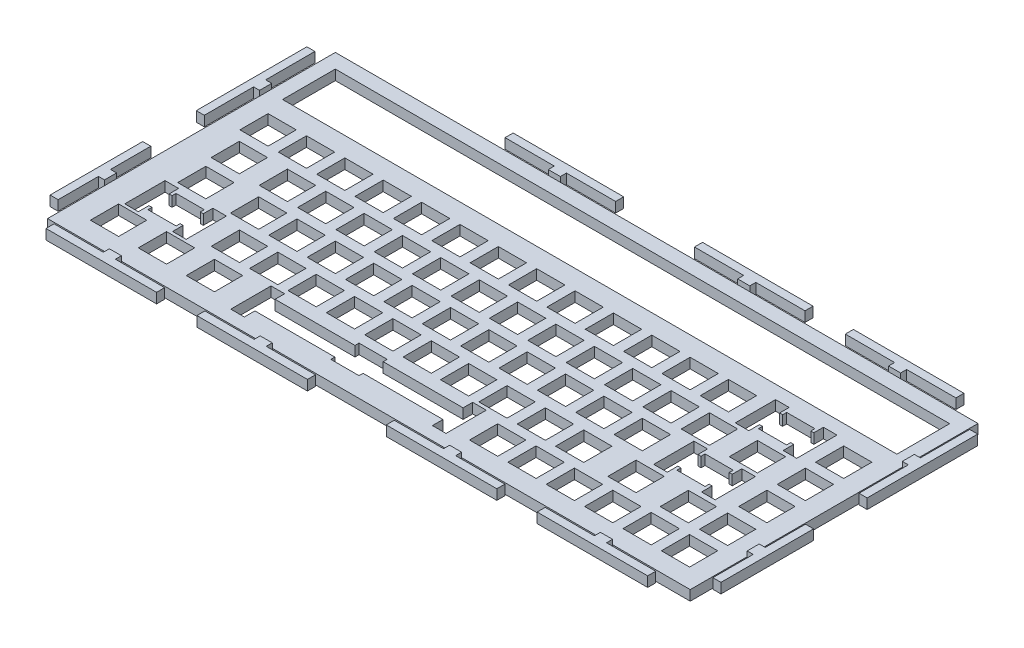
from build123d import *

# Parameters (mm, degrees)
SKETCH1_W           = 319.08
SKETCH1_H           = 142.875
SKETCH1_W_2         = 14
SKETCH1_H_2         = 14
SKETCH1_W_3         = 305
SKETCH1_H_3         = 26.2
BOSS_EXTRUDE2_DEPTH = 2.5
BOSS_EXTRUDE3_DEPTH = 2.5


with BuildPart() as part:
    # Sketch1 → Boss-Extrude2 (new, symmetric)
    with BuildSketch(Plane(origin=(0, 0, 0), x_dir=(1, 0, 0), z_dir=(0, 1, 0))):
        with Locations((55.118496059, 23.552072889)):
            Rectangle(SKETCH1_W, SKETCH1_H)
        with Locations((-68.754503941, 44.995572889)):
            Rectangle(SKETCH1_W_2, SKETCH1_H_2, mode=Mode.SUBTRACT)
        with Locations((-87.826503941, 44.995572889)):
            Rectangle(SKETCH1_W_2, SKETCH1_H_2, mode=Mode.SUBTRACT)
        with Locations((140.749496059, 44.995572889)):
            Rectangle(SKETCH1_W_2, SKETCH1_H_2, mode=Mode.SUBTRACT)
        with Locations((-30.654503941, 44.995572889)):
            Rectangle(SKETCH1_W_2, SKETCH1_H_2, mode=Mode.SUBTRACT)
        with Locations((-49.704503941, 44.995572889)):
            Rectangle(SKETCH1_W_2, SKETCH1_H_2, mode=Mode.SUBTRACT)
        with Locations((7.445496059, 44.995572889)):
            Rectangle(SKETCH1_W_2, SKETCH1_H_2, mode=Mode.SUBTRACT)
        with Locations((-11.604503941, 44.995572889)):
            Rectangle(SKETCH1_W_2, SKETCH1_H_2, mode=Mode.SUBTRACT)
        with Locations((45.545496059, 44.995572889)):
            Rectangle(SKETCH1_W_2, SKETCH1_H_2, mode=Mode.SUBTRACT)
        with Locations((26.495496059, 44.995572889)):
            Rectangle(SKETCH1_W_2, SKETCH1_H_2, mode=Mode.SUBTRACT)
        with Locations((174.183496059, 25.945572889)):
            Rectangle(SKETCH1_W_2, SKETCH1_H_2, mode=Mode.SUBTRACT)
        with Locations((83.645496059, 44.995572889)):
            Rectangle(SKETCH1_W_2, SKETCH1_H_2, mode=Mode.SUBTRACT)
        with Locations((64.595496059, 44.995572889)):
            Rectangle(SKETCH1_W_2, SKETCH1_H_2, mode=Mode.SUBTRACT)
        with Locations((121.722496059, 44.995572889)):
            Rectangle(SKETCH1_W_2, SKETCH1_H_2, mode=Mode.SUBTRACT)
        with Locations((102.695496059, 44.995572889)):
            Rectangle(SKETCH1_W_2, SKETCH1_H_2, mode=Mode.SUBTRACT)
        Polygon((162.399496059, 52.245572889), (176.399496059, 52.245572889), (176.399496059, 50.245572889), (177.899496059, 50.245572889), (177.899496059, 54.995572889), (184.649496059, 54.995572889), (184.649496059, 34.995572889), (177.899496059, 34.995572889), (177.899496059, 40.245572889), (176.399496059, 40.245572889), (176.399496059, 38.245572889), (162.399496059, 38.245572889), (162.399496059, 40.245572889), (160.899496059, 40.245572889), (160.899496059, 34.995572889), (154.149496059, 34.995572889), (154.149496059, 54.995572889), (160.899496059, 54.995572889), (160.899496059, 50.245572889), (162.399496059, 50.245572889), align=None, mode=Mode.SUBTRACT)
        with Locations((-40.126503941, 25.945572889)):
            Rectangle(SKETCH1_W_2, SKETCH1_H_2, mode=Mode.SUBTRACT)
        with Locations((-59.176503941, 25.945572889)):
            Rectangle(SKETCH1_W_2, SKETCH1_H_2, mode=Mode.SUBTRACT)
        with Locations((-2.051503941, 25.945572889)):
            Rectangle(SKETCH1_W_2, SKETCH1_H_2, mode=Mode.SUBTRACT)
        with Locations((-21.076503941, 25.945572889)):
            Rectangle(SKETCH1_W_2, SKETCH1_H_2, mode=Mode.SUBTRACT)
        with Locations((36.073496059, 25.945572889)):
            Rectangle(SKETCH1_W_2, SKETCH1_H_2, mode=Mode.SUBTRACT)
        with Locations((16.948496059, 25.945572889)):
            Rectangle(SKETCH1_W_2, SKETCH1_H_2, mode=Mode.SUBTRACT)
        with Locations((74.148496059, 25.945572889)):
            Rectangle(SKETCH1_W_2, SKETCH1_H_2, mode=Mode.SUBTRACT)
        with Locations((55.123496059, 25.945572889)):
            Rectangle(SKETCH1_W_2, SKETCH1_H_2, mode=Mode.SUBTRACT)
        Polygon((159.986496059, 14.145572889), (173.986496059, 14.145572889), (173.986496059, 12.145572889), (175.486496059, 12.145572889), (175.486496059, 16.895572889), (182.236496059, 16.895572889), (182.236496059, -3.104427111), (175.486496059, -3.104427111), (175.486496059, 2.145572889), (173.986496059, 2.145572889), (173.986496059, 0.145572889), (159.986496059, 0.145572889), (159.986496059, 2.145572889), (158.486496059, 2.145572889), (158.486496059, -3.104427111), (151.736496059, -3.104427111), (151.736496059, 16.895572889), (158.486496059, 16.895572889), (158.486496059, 12.145572889), (159.986496059, 12.145572889), align=None, mode=Mode.SUBTRACT)
        with Locations((-35.363503941, 6.895572889)):
            Rectangle(SKETCH1_W_2, SKETCH1_H_2, mode=Mode.SUBTRACT)
        with Locations((-54.413503941, 6.895572889)):
            Rectangle(SKETCH1_W_2, SKETCH1_H_2, mode=Mode.SUBTRACT)
        with Locations((112.273496059, 25.945572889)):
            Rectangle(SKETCH1_W_2, SKETCH1_H_2, mode=Mode.SUBTRACT)
        with Locations((93.223496059, 25.945572889)):
            Rectangle(SKETCH1_W_2, SKETCH1_H_2, mode=Mode.SUBTRACT)
        with Locations((-83.063503941, 25.945572889)):
            Rectangle(SKETCH1_W_2, SKETCH1_H_2, mode=Mode.SUBTRACT)
        with Locations((131.323496059, 25.945572889)):
            Rectangle(SKETCH1_W_2, SKETCH1_H_2, mode=Mode.SUBTRACT)
        with Locations((150.373496059, 25.945572889)):
            Rectangle(SKETCH1_W_2, SKETCH1_H_2, mode=Mode.SUBTRACT)
        with Locations((2.736496059, 6.895572889)):
            Rectangle(SKETCH1_W_2, SKETCH1_H_2, mode=Mode.SUBTRACT)
        with Locations((-16.313503941, 6.895572889)):
            Rectangle(SKETCH1_W_2, SKETCH1_H_2, mode=Mode.SUBTRACT)
        with Locations((40.836496059, 6.895572889)):
            Rectangle(SKETCH1_W_2, SKETCH1_H_2, mode=Mode.SUBTRACT)
        with Locations((21.786496059, 6.895572889)):
            Rectangle(SKETCH1_W_2, SKETCH1_H_2, mode=Mode.SUBTRACT)
        with Locations((78.936496059, 6.895572889)):
            Rectangle(SKETCH1_W_2, SKETCH1_H_2, mode=Mode.SUBTRACT)
        with Locations((59.886496059, 6.895572889)):
            Rectangle(SKETCH1_W_2, SKETCH1_H_2, mode=Mode.SUBTRACT)
        with Locations((117.036496059, 6.895572889)):
            Rectangle(SKETCH1_W_2, SKETCH1_H_2, mode=Mode.SUBTRACT)
        with Locations((97.986496059, 6.895572889)):
            Rectangle(SKETCH1_W_2, SKETCH1_H_2, mode=Mode.SUBTRACT)
        with Locations((-80.607503941, 6.895572889)):
            Rectangle(SKETCH1_W_2, SKETCH1_H_2, mode=Mode.SUBTRACT)
        with Locations((136.086496059, 6.895572889)):
            Rectangle(SKETCH1_W_2, SKETCH1_H_2, mode=Mode.SUBTRACT)
        with Locations((-25.838503941, -12.154427111)):
            Rectangle(SKETCH1_W_2, SKETCH1_H_2, mode=Mode.SUBTRACT)
        with Locations((-44.888503941, -12.154427111)):
            Rectangle(SKETCH1_W_2, SKETCH1_H_2, mode=Mode.SUBTRACT)
        with Locations((12.261496059, -12.154427111)):
            Rectangle(SKETCH1_W_2, SKETCH1_H_2, mode=Mode.SUBTRACT)
        with Locations((-6.788503941, -12.154427111)):
            Rectangle(SKETCH1_W_2, SKETCH1_H_2, mode=Mode.SUBTRACT)
        with Locations((50.361496059, -12.154427111)):
            Rectangle(SKETCH1_W_2, SKETCH1_H_2, mode=Mode.SUBTRACT)
        with Locations((31.311496059, -12.154427111)):
            Rectangle(SKETCH1_W_2, SKETCH1_H_2, mode=Mode.SUBTRACT)
        with Locations((88.461496059, -12.654427111)):
            Rectangle(SKETCH1_W_2, SKETCH1_H_2, mode=Mode.SUBTRACT)
        with Locations((69.411496059, -12.654427111)):
            Rectangle(SKETCH1_W_2, SKETCH1_H_2, mode=Mode.SUBTRACT)
        with Locations((126.561496059, -12.654427111)):
            Rectangle(SKETCH1_W_2, SKETCH1_H_2, mode=Mode.SUBTRACT)
        with Locations((107.511496059, -12.654427111)):
            Rectangle(SKETCH1_W_2, SKETCH1_H_2, mode=Mode.SUBTRACT)
        Polygon((-83.344503941, -5.154427111), (-69.344503941, -5.154427111), (-69.344503941, -7.154427111), (-67.844503941, -7.154427111), (-67.844503941, -2.404427111), (-61.094503941, -2.404427111), (-61.094503941, -22.404427111), (-67.844503941, -22.404427111), (-67.844503941, -17.154427111), (-69.344503941, -17.154427111), (-69.344503941, -19.154427111), (-83.344503941, -19.154427111), (-83.344503941, -17.154427111), (-84.844503941, -17.154427111), (-84.844503941, -22.404427111), (-91.594503941, -22.404427111), (-91.594503941, -2.404427111), (-84.844503941, -2.404427111), (-84.844503941, -7.154427111), (-83.344503941, -7.154427111), align=None, mode=Mode.SUBTRACT)
        with Locations((152.523496059, -12.654427111)):
            Rectangle(SKETCH1_W_2, SKETCH1_H_2, mode=Mode.SUBTRACT)
        with Locations((178.485496059, -12.654427111)):
            Rectangle(SKETCH1_W_2, SKETCH1_H_2, mode=Mode.SUBTRACT)
        with Locations((55.223496059, 74.745572889)):
            Rectangle(SKETCH1_W_3, SKETCH1_H_3, mode=Mode.SUBTRACT)
        with Locations((197.995496059, 25.945572889)):
            Rectangle(SKETCH1_W_2, SKETCH1_H_2, mode=Mode.SUBTRACT)
        with Locations((197.974496059, 44.995572889)):
            Rectangle(SKETCH1_W_2, SKETCH1_H_2, mode=Mode.SUBTRACT)
        with Locations((197.942496059, 6.895572889)):
            Rectangle(SKETCH1_W_2, SKETCH1_H_2, mode=Mode.SUBTRACT)
        with Locations((197.985496059, -12.654427111)):
            Rectangle(SKETCH1_W_2, SKETCH1_H_2, mode=Mode.SUBTRACT)
        with Locations((-86.094503941, -30.954427111)):
            Rectangle(SKETCH1_W_2, SKETCH1_H_2, mode=Mode.SUBTRACT)
        with Locations((-62.294503941, -30.954427111)):
            Rectangle(SKETCH1_W_2, SKETCH1_H_2, mode=Mode.SUBTRACT)
        with Locations((-38.494503941, -30.954427111)):
            Rectangle(SKETCH1_W_2, SKETCH1_H_2, mode=Mode.SUBTRACT)
        Polygon((26.439496059, -24.114427111), (40.439496059, -24.114427111), (40.439496059, -26.114427111), (80.123496059, -26.114427111), (80.123496059, -21.364427111), (86.873496059, -21.364427111), (86.873496059, -41.364427111), (80.123496059, -41.364427111), (80.123496059, -36.114427111), (40.439496059, -36.114427111), (40.439496059, -38.114427111), (26.439496059, -38.114427111), (26.439496059, -36.114427111), (-13.244503941, -36.114427111), (-13.244503941, -41.364427111), (-19.994503941, -41.364427111), (-19.994503941, -21.364427111), (-13.244503941, -21.364427111), (-13.244503941, -26.114427111), (26.439496059, -26.114427111), align=None, mode=Mode.SUBTRACT)
        with Locations((102.543496059, -31.364427111)):
            Rectangle(SKETCH1_W_2, SKETCH1_H_2, mode=Mode.SUBTRACT)
        with Locations((121.593496059, -31.364427111)):
            Rectangle(SKETCH1_W_2, SKETCH1_H_2, mode=Mode.SUBTRACT)
        with Locations((140.643496059, -31.364427111)):
            Rectangle(SKETCH1_W_2, SKETCH1_H_2, mode=Mode.SUBTRACT)
        with Locations((159.693496059, -31.364427111)):
            Rectangle(SKETCH1_W_2, SKETCH1_H_2, mode=Mode.SUBTRACT)
        with Locations((178.743496059, -31.364427111)):
            Rectangle(SKETCH1_W_2, SKETCH1_H_2, mode=Mode.SUBTRACT)
        with Locations((197.793496059, -31.364427111)):
            Rectangle(SKETCH1_W_2, SKETCH1_H_2, mode=Mode.SUBTRACT)
    extrude(amount=BOSS_EXTRUDE2_DEPTH, both=True)

    # Sketch2 → Boss-Extrude3 (add, symmetric)
    with BuildSketch(Plane(origin=(0, 2.5, 0), x_dir=(1, 0, 0), z_dir=(0, 1, 0))):
        Polygon((-104.421503941, 63.389572889), (-104.421503941, 57.389572889), (-107.421503941, 57.389572889), (-107.421503941, 32.945572889), (-111.421503941, 32.945572889), (-111.421503941, 87.845572889), (-107.421503941, 87.845572889), (-107.421503941, 63.389572889), align=None)
        Polygon((-104.421503941, -13.635427111), (-104.421503941, -19.635427111), (-107.421503941, -19.635427111), (-107.421503941, -39.635427111), (-111.421503941, -39.635427111), (-111.421503941, 6.364572889), (-107.421503941, 6.364572889), (-107.421503941, -13.635427111), align=None)
        Polygon((221.658496059, -39.635427111), (217.658496059, -39.635427111), (217.658496059, -19.635427111), (214.658496059, -19.635427111), (214.658496059, -13.635427111), (217.658496059, -13.635427111), (217.658496059, 6.364572889), (221.658496059, 6.364572889), align=None)
        Polygon((214.658496059, 63.389572889), (217.658496059, 63.389572889), (217.658496059, 87.845572889), (221.658496059, 87.845572889), (221.658496059, 32.945572889), (217.658496059, 32.945572889), (217.658496059, 57.389572889), (214.658496059, 57.389572889), align=None)
        Polygon((170.233496059, 94.989572889), (176.233496059, 94.989572889), (176.233496059, 97.989572889), (200.683496059, 97.989572889), (200.683496059, 101.989572889), (145.783496059, 101.989572889), (145.783496059, 97.989572889), (170.233496059, 97.989572889), align=None)
        Polygon((95.333496059, 94.989572889), (101.333496059, 94.989572889), (101.333496059, 97.989572889), (125.783496059, 97.989572889), (125.783496059, 101.989572889), (70.883496059, 101.989572889), (70.883496059, 97.989572889), (95.333496059, 97.989572889), align=None)
        Polygon((7.298496059, 97.989572889), (7.298496059, 94.989572889), (1.298496059, 94.989572889), (1.298496059, 97.989572889), (-23.151503941, 97.989572889), (-23.151503941, 101.989572889), (31.748496059, 101.989572889), (31.748496059, 97.989572889), align=None)
        Polygon((145.783496059, -51.037960482), (170.233496059, -51.037960482), (170.233496059, -48.037960482), (176.233496059, -48.037960482), (176.233496059, -51.037960482), (200.683496059, -51.037960482), (200.683496059, -55.037960482), (145.783496059, -55.037960482), align=None)
        Polygon((95.333496059, -51.037960482), (95.333496059, -48.037960482), (101.333496059, -48.037960482), (101.333496059, -51.037960482), (125.783496059, -51.037960482), (125.783496059, -55.037960482), (70.883496059, -55.037960482), (70.883496059, -51.037960482), align=None)
        Polygon((31.748496059, -51.037960482), (7.298496059, -51.037960482), (7.298496059, -48.037960482), (1.298496059, -48.037960482), (1.298496059, -51.037960482), (-23.151503941, -51.037960482), (-23.151503941, -55.037960482), (31.748496059, -55.037960482), align=None)
        Polygon((-43.151503941, -55.037960482), (-43.151503941, -51.037960482), (-67.601503941, -51.037960482), (-67.601503941, -48.037960482), (-73.601503941, -48.037960482), (-73.601503941, -51.037960482), (-98.051503941, -51.037960482), (-98.051503941, -55.037960482), align=None)
    extrude(amount=BOSS_EXTRUDE3_DEPTH, both=True)


with BuildPart() as boss_extrude3_piece_1:
    # of the separate pieces the step leaves, piece 1, a body of its own (boss_extrude3_pieces)
    add(part.part.solids().sort_by_distance((-104.421503941, -2.5, -94.989572889))[0])


with BuildPart() as boss_extrude3_piece_2:
    # of the separate pieces the step leaves, piece 2, a body of its own (boss_extrude3_pieces)
    add(part.part.solids().sort_by_distance((145.783496059, 0, 51.037960482))[0])


with BuildPart() as boss_extrude3_piece_3:
    # of the separate pieces the step leaves, piece 3, a body of its own (boss_extrude3_pieces)
    add(part.part.solids().sort_by_distance((-43.151503941, 0, 55.037960482))[0])


with BuildPart() as boss_extrude3_piece_4:
    # of the separate pieces the step leaves, piece 4, a body of its own (boss_extrude3_pieces)
    add(part.part.solids().sort_by_distance((95.333496059, 0, 51.037960482))[0])


with BuildPart() as boss_extrude3_piece_5:
    # of the separate pieces the step leaves, piece 5, a body of its own (boss_extrude3_pieces)
    add(part.part.solids().sort_by_distance((31.748496059, 0, 51.037960482))[0])


solid = Compound([boss_extrude3_piece_1.part, boss_extrude3_piece_2.part, boss_extrude3_piece_3.part, boss_extrude3_piece_4.part, boss_extrude3_piece_5.part])
